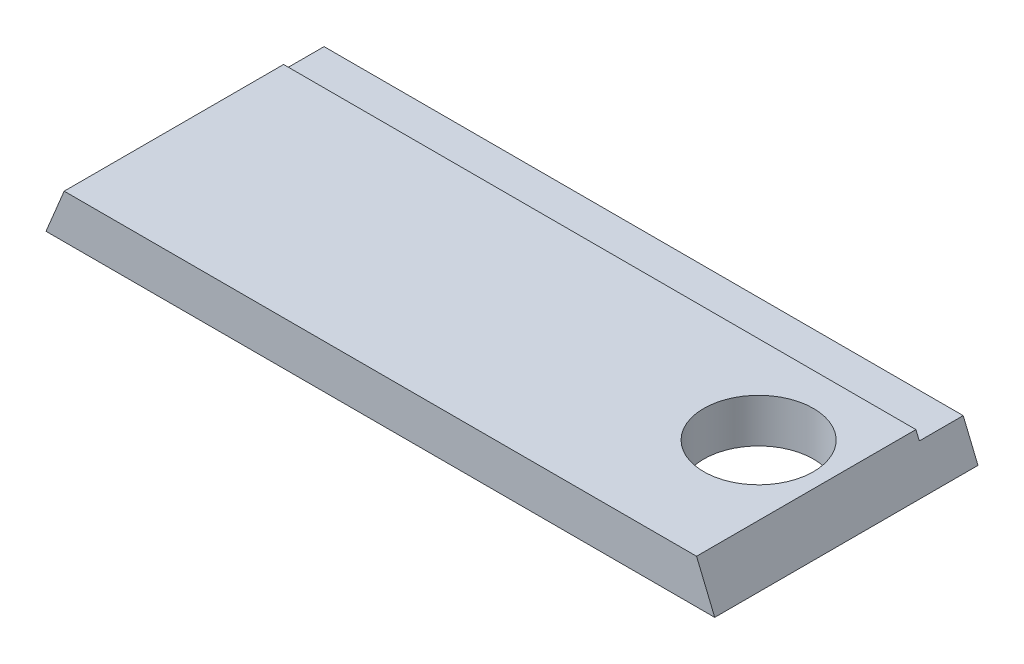
from build123d import *

# Parameters (mm, degrees)
BOSS_EXTRUDE1_DEPTH = 76.2
SKETCH2_W           = 193.548
SKETCH2_H           = 12.7
CUT_EXTRUDE1_DEPTH  = 2.3622
SKETCH3_R           = 15.875
CUT_EXTRUDE2_DEPTH  = 209.395197411


with BuildPart() as part:
    # Sketch1 → Boss-Extrude1 (new body)
    with BuildSketch(Plane.XY):
        Polygon((0, 0), (193.548, 0), (188.287487758, 12.7), (5.260512242, 12.7), align=None)
    extrude(amount=BOSS_EXTRUDE1_DEPTH)

    # Sketch2 → Cut-Extrude1 (cut)
    with BuildSketch(Plane(origin=(0, 12.7, 0), x_dir=(1, 0, 0), z_dir=(0, 1, 0))):
        with Locations((96.774, -6.35)):
            Rectangle(SKETCH2_W, SKETCH2_H)
    extrude(amount=-CUT_EXTRUDE1_DEPTH, mode=Mode.SUBTRACT)

    # Sketch3 → Cut-Extrude2 (cut, through all)
    with BuildSketch(Plane.XZ):
        with Locations((168.148, 38.1)):
            Circle(SKETCH3_R)
    extrude(amount=-CUT_EXTRUDE2_DEPTH, mode=Mode.SUBTRACT)


solid = part.part
